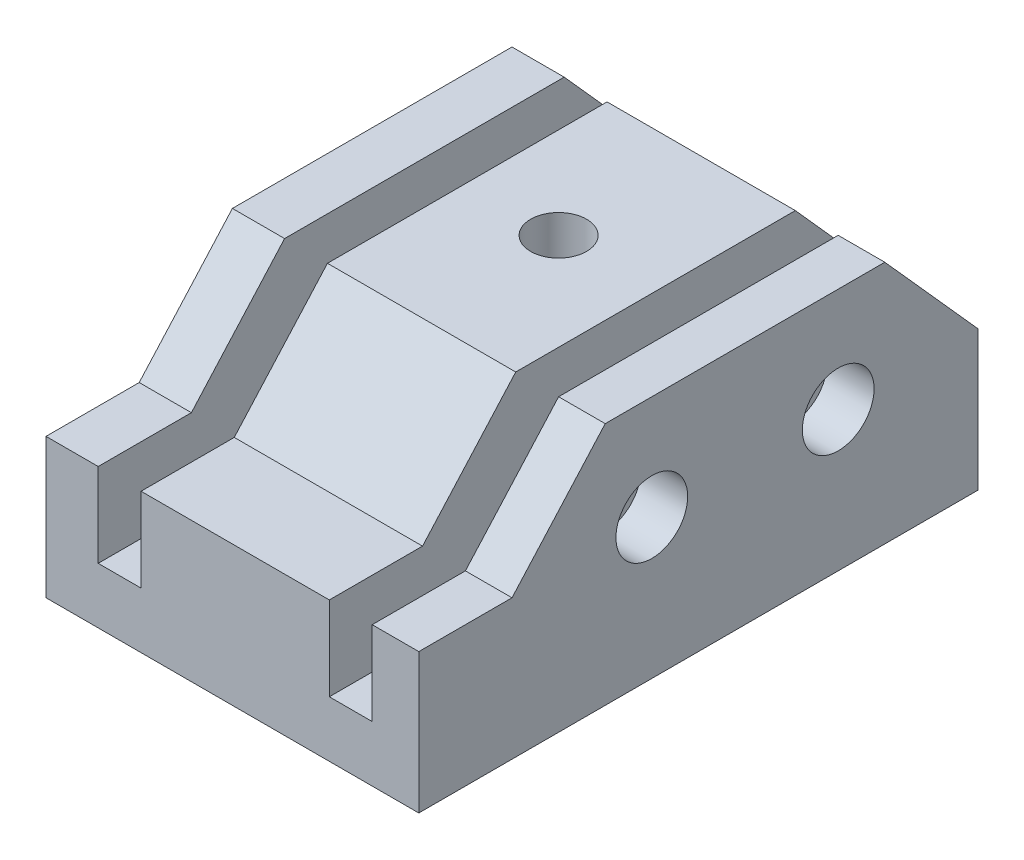
from build123d import *

# Parameters (mm, degrees)
SKETCH1_W           = 63.5
SKETCH1_H           = 6.35
BOSS_EXTRUDE1_DEPTH = 50.8
BOSS_EXTRUDE2_DEPTH = 50.8
SKETCH10_W          = 5.842
SKETCH10_H          = 25.629031657
CUT_EXTRUDE1_DEPTH  = 88.854357354
LPATTERN3_COUNT     = 2
LPATTERN3_PITCH     = 31.496
SKETCH11_R          = 4.8895
CUT_EXTRUDE2_DEPTH  = 88.854357354
BOSS_EXTRUDE3_DEPTH = 12.7
SKETCH23_R          = 3.81
CUT_EXTRUDE6_DEPTH  = 88.854357354
SKETCH24_W          = 22.86
SKETCH24_H          = 58.42
CUT_EXTRUDE7_DEPTH  = 4.58
SKETCH25_R          = 7
CUT_EXTRUDE8_DEPTH  = 2.799999956
SKETCH26_R          = 3
CUT_EXTRUDE9_DEPTH  = 10


with BuildPart() as part:
    # Sketch1 → Boss-Extrude1 (new body)
    with BuildSketch(Plane(origin=(0, 0, 0), x_dir=(0, 0, -1), z_dir=(1, 0, 0))):
        with Locations((31.75, 3.175)):
            Rectangle(SKETCH1_W, SKETCH1_H)
    extrude(amount=-BOSS_EXTRUDE1_DEPTH)

    # Sketch2 → Boss-Extrude2 (add)
    with BuildSketch(Plane(origin=(0, 0, 0), x_dir=(0, 0, -1), z_dir=(1, 0, 0))):
        Polygon((0, 6.35), (0, 19.05), (12.7, 33.249031657), (50.8, 33.249031657), (63.5, 19.05), (63.5, 6.35), align=None)
    extrude(amount=-BOSS_EXTRUDE2_DEPTH)

    # Sketch10 → Cut-Extrude1 (cut, through all)
    with BuildSketch(Plane(origin=(0, 0, -63.5), x_dir=(-1, 0, 0), z_dir=(0, 0, -1))):
        with Locations((9.271, 20.434515829)):
            Rectangle(SKETCH10_W, SKETCH10_H)
    cut_extrude1 = extrude(amount=-CUT_EXTRUDE1_DEPTH, mode=Mode.SUBTRACT)

    # LPattern3: Cut-Extrude1 ×2
    with Locations(*[(-i * LPATTERN3_PITCH, 0, 0) for i in range(1, LPATTERN3_COUNT)]):
        add(cut_extrude1, mode=Mode.SUBTRACT)

    # Sketch11 → Cut-Extrude2 (cut, through all)
    with BuildSketch(Plane(origin=(0, 0, 0), x_dir=(0, 0, -1), z_dir=(1, 0, 0))):
        with Locations((19.05, 19.05)):
            Circle(SKETCH11_R)
        with Locations((44.45, 19.05)):
            Circle(SKETCH11_R)
    extrude(amount=-CUT_EXTRUDE2_DEPTH, mode=Mode.SUBTRACT)

    # Sketch22 → Boss-Extrude3 (add)
    with BuildSketch(Plane.XY):
        Polygon((0, 0), (-50.8, 0), (-50.8, 7.62), (-50.8, 19.05), (-43.688, 19.05), (-43.688, 7.62), (-37.846, 7.62), (-37.846, 19.05), (-12.192, 19.05), (-12.192, 7.62), (-6.35, 7.62), (-6.35, 19.05), (0, 19.05), (0, 7.62), align=None)
    extrude(amount=BOSS_EXTRUDE3_DEPTH)

    # Sketch23 → Cut-Extrude6 (cut, through all)
    with BuildSketch(Plane(origin=(0, 33.249031657, 0), x_dir=(1, 0, 0), z_dir=(0, 1, 0))):
        with Locations((-25.4, 31.75)):
            Circle(SKETCH23_R)
    extrude(amount=-CUT_EXTRUDE6_DEPTH, mode=Mode.SUBTRACT)

    # Sketch24 → Cut-Extrude7 (cut)
    with BuildSketch(Plane.XZ):
        with Locations((-25.4, -21.59)):
            Rectangle(SKETCH24_W, SKETCH24_H)
    extrude(amount=-CUT_EXTRUDE7_DEPTH, mode=Mode.SUBTRACT)

    # Sketch25 → Cut-Extrude8 (cut)
    with BuildSketch(Plane.XZ.offset(-4.58)):
        with Locations((-25.4, -31.75)):
            Circle(SKETCH25_R)
    extrude(amount=-CUT_EXTRUDE8_DEPTH, mode=Mode.SUBTRACT)

    # Sketch26 → Cut-Extrude9 (cut)
    with BuildSketch(Plane(origin=(0, 4.58, 0), x_dir=(-1, 0, 0), z_dir=(0, -1, 0))):
        with Locations((30.4, 46.15)):
            Circle(SKETCH26_R)
        with Locations((20.4, 46.15)):
            Circle(SKETCH26_R)
        with Locations((20.4, -1.89703266)):
            Circle(SKETCH26_R)
        with Locations((30.4, -1.89703266)):
            Circle(SKETCH26_R)
    extrude(amount=-CUT_EXTRUDE9_DEPTH, mode=Mode.SUBTRACT)


solid = part.part
